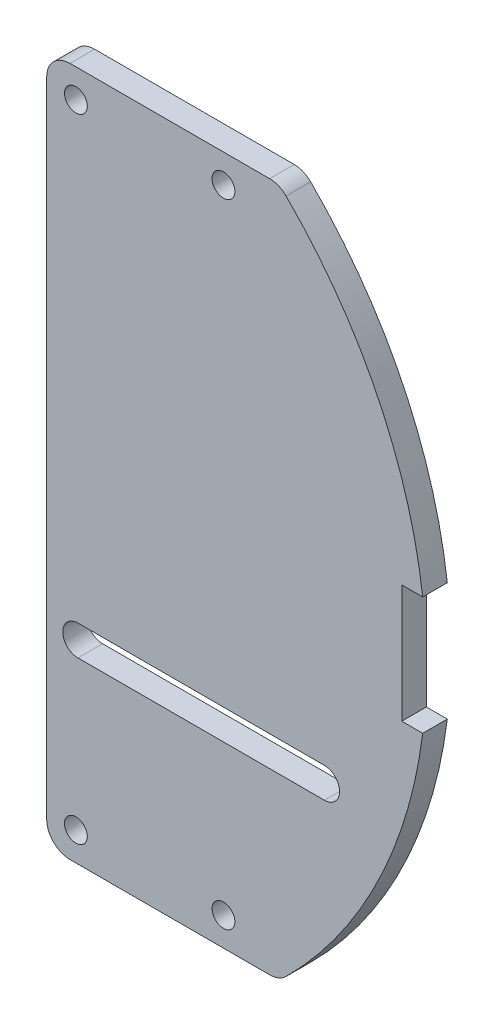
from build123d import *

# Parameters (mm, degrees)
BOSS_EXTRUDE1_DEPTH = 3.175
SKETCH2_R           = 1.4732
CUT_EXTRUDE1_DEPTH  = 77.054419002
CUT_EXTRUDE2_DEPTH  = 77.054419002
FILLET1_R           = 3
CUT_EXTRUDE5_DEPTH  = 76.671726887


with BuildPart() as part:
    # Sketch1 → Boss-Extrude1 (new body)
    with BuildSketch(Plane.XY):
        with BuildLine():
            Line((12.587486719, 44.5), (42.587486719, 44.5))
            ThreePointArc((42.587486719, 44.5), (61.594999998, 0), (42.587486719, -44.5))
            Line((42.587486719, -44.5), (12.587486719, -44.5))
            Line((12.587486719, -44.5), (12.587486719, 44.5))
        make_face()
    extrude(amount=BOSS_EXTRUDE1_DEPTH)

    # Sketch2 → Cut-Extrude1 (cut, through all)
    with BuildSketch(Plane.XY.offset(3.175)):
        with Locations((16.354311186, -40.81189221)):
            Circle(SKETCH2_R)
        with Locations((35.404311186, -40.81189221)):
            Circle(SKETCH2_R)
        with Locations((16.354311186, 40.81189221)):
            Circle(SKETCH2_R)
        with Locations((35.404311186, 40.81189221)):
            Circle(SKETCH2_R)
    extrude(amount=-CUT_EXTRUDE1_DEPTH, mode=Mode.SUBTRACT)

    # Sketch3 → Cut-Extrude2 (cut, through all)
    with BuildSketch(Plane.XY.offset(3.175)):
        with BuildLine():
            Line((58.42, 7.62), (61.121842454, 7.62))
            ThreePointArc((61.121842454, 7.62), (61.595, 0), (61.121842454, -7.62))
            Line((61.121842454, -7.62), (58.42, -7.62))
            Line((58.42, -7.62), (58.42, 7.62))
        make_face()
    extrude(amount=-CUT_EXTRUDE2_DEPTH, mode=Mode.SUBTRACT)

    # Fillet1
    fillet1_edges = [part.edges().sort_by_distance(p)[0] for p in [
        (12.587486719, -44.5, 1.5875),
        (42.587486719, -44.5, 1.5875),
        (12.587486719, 44.5, 1.5875),
        (42.587486719, 44.5, 1.5875),
    ]]
    fillet(fillet1_edges, radius=FILLET1_R)

    # Sketch5 → Cut-Extrude5 (cut, through all)
    with BuildSketch(Plane.XY.offset(3.175)):
        with BuildLine():
            Line((16.612162061, -17.554236987), (48.444763602, -17.554236987))
            ThreePointArc((48.444763602, -17.554236987), (50.390526615, -19.5), (48.444763602, -21.445763013))
            Line((48.444763602, -21.445763013), (16.612162061, -21.445763013))
            ThreePointArc((16.612162061, -21.445763013), (14.666399048, -19.5), (16.612162061, -17.554236987))
        make_face()
    extrude(amount=-CUT_EXTRUDE5_DEPTH, mode=Mode.SUBTRACT)


solid = part.part
